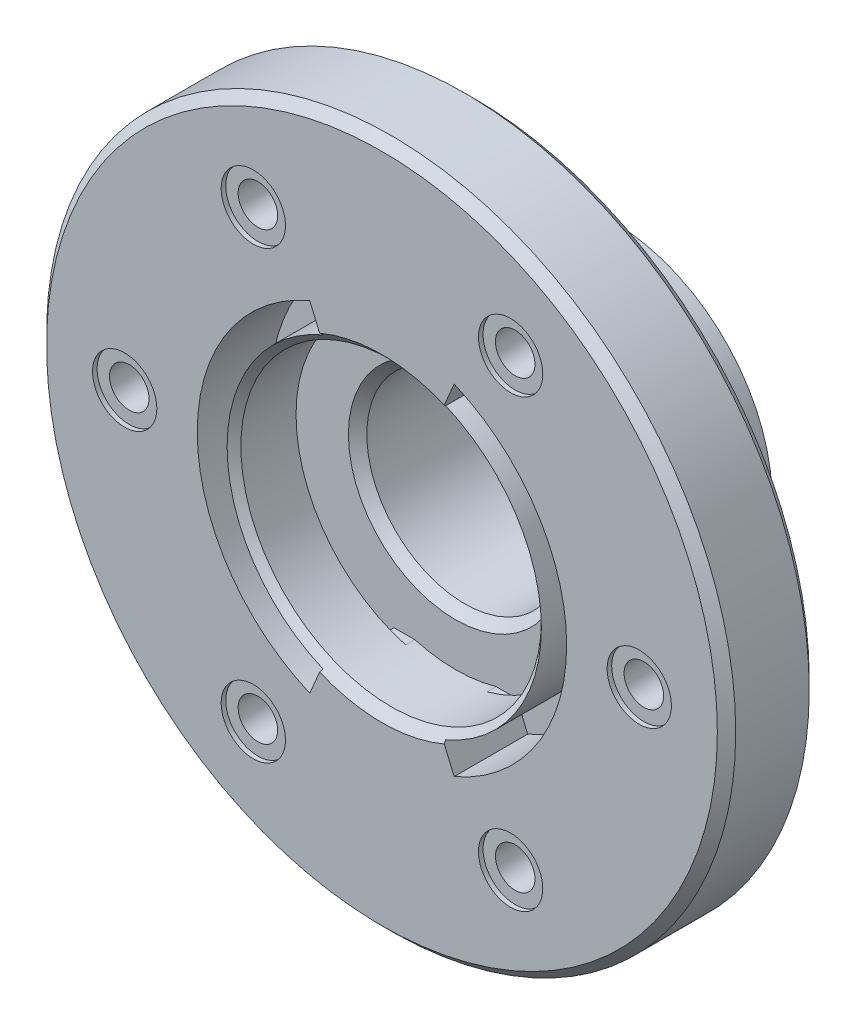
from build123d import *

# Parameters (mm, degrees)
SKETCH1_R                             = 37.5
BASE_PLATE_DEPTH                      = 5
SKETCH2_R                             = 6
PIN_DEPTH                             = 30
SKETCH11_R                            = 4
SCREWINSERTS_DEPTH                    = 5
INSERTSCIRPATTERN3_COUNT              = 6
SKETCH10_R                            = 2.15
SCREW_HOLES_DEPTH                     = 35
SCREWHOLEPATTERN1_OUTLINE_R           = 2.15
SCREWHOLEPATTERN1_DEPTH               = 5
SKETCH9_R                             = 3.5
PINHOLES_DEPTH                        = 0.5
PINHOLECIRPATTERN2_COUNT              = 6
SKETCH3_R                             = 17.45
OUTPUT_SHAFT_DEPTH                    = 15
SKETCH5_R                             = 16.35
BEARINGHOLE_DEPTH                     = 8
SKETCH6_R                             = 10.65
INPUTSHAFT_HOLE_DEPTH                 = 66.24185773
COMPLIANCE_CUT_DEPTH                  = 8
CHAMFER_2_SIZE                        = 1
WALL_COMPLIANCE_CIT_REACH             = 65.541
SKETCH13_W                            = 1
SKETCH13_H                            = 31.47761194
WALL_COMPLIANCE_CIT_DIRECTION_2_REACH = 65.541


# Read off the part's stored shape, not the designer's step: ScrewHolePattern1
with BuildPart() as part:
    # Sketch1 → Base Plate (new, symmetric)
    with BuildSketch(Plane.XY):
        Circle(SKETCH1_R)
    extrude(amount=BASE_PLATE_DEPTH, both=True)

    # Sketch11 → ScrewInserts (cut)
    with BuildSketch(Plane(origin=(0, 0, -5), x_dir=(-1, 0, 0), z_dir=(0, 0, -1))):
        with Locations((28, 0)):
            Circle(SKETCH11_R)
    screwinserts = extrude(amount=-SCREWINSERTS_DEPTH, mode=Mode.SUBTRACT)

    # InsertsCirPattern3: ScrewInserts ×6 about axis
    insertscirpattern3_axis = Axis((0, 0, 0), (0, 0, 1))
    for i in range(1, INSERTSCIRPATTERN3_COUNT):
        add(screwinserts.rotate(insertscirpattern3_axis, i * 360 / INSERTSCIRPATTERN3_COUNT), mode=Mode.SUBTRACT)


with BuildPart() as body_2:
    # Sketch2 → Pin (new body)
    with BuildSketch(Plane.XY.offset(5)):
        with Locations((-28, 0)):
            Circle(SKETCH2_R)
    extrude(amount=PIN_DEPTH)


with BuildPart() as screw_holes_tool:
    # Sketch10 → Screw Holes (new body)
    with BuildSketch(Plane.XY.offset(35)):
        with Locations((-28, 0)):
            Circle(SKETCH10_R)
    extrude(amount=-SCREW_HOLES_DEPTH)


with BuildPart() as part_1:
    add(part.part)

    # Screw Holes: cut by screw_holes_tool
    add(screw_holes_tool.part, mode=Mode.SUBTRACT)

    # ScrewHolePattern1 outline → ScrewHolePattern1 (cut)
    with BuildSketch(Plane.XY):
        with Locations((-14, 24.248711306)):
            Circle(SCREWHOLEPATTERN1_OUTLINE_R)
        with Locations((14, 24.248711306)):
            Circle(SCREWHOLEPATTERN1_OUTLINE_R)
        with Locations((28, 0)):
            Circle(SCREWHOLEPATTERN1_OUTLINE_R)
        with Locations((14, -24.248711306)):
            Circle(SCREWHOLEPATTERN1_OUTLINE_R)
        with Locations((-14, -24.248711306)):
            Circle(SCREWHOLEPATTERN1_OUTLINE_R)
    extrude(amount=SCREWHOLEPATTERN1_DEPTH, mode=Mode.SUBTRACT)

    # Sketch9 → PinHoles (cut)
    with BuildSketch(Plane.XY.offset(5)):
        with Locations((-28, 0)):
            Circle(SKETCH9_R)
    pinholes = extrude(amount=-PINHOLES_DEPTH, mode=Mode.SUBTRACT)

    # PinHoleCirPattern2: PinHoles ×6 about axis
    pinholecirpattern2_axis = Axis((0, 0, 0), (0, 0, 1))
    for i in range(1, PINHOLECIRPATTERN2_COUNT):
        add(pinholes.rotate(pinholecirpattern2_axis, i * 360 / PINHOLECIRPATTERN2_COUNT), mode=Mode.SUBTRACT)

    # Sketch3 → Output Shaft (add)
    with BuildSketch(Plane(origin=(0, 0, -5), x_dir=(-1, 0, 0), z_dir=(0, 0, -1))):
        Circle(SKETCH3_R)
    extrude(amount=OUTPUT_SHAFT_DEPTH)

    # Sketch5 → BearingHole (cut)
    with BuildSketch(Plane.XY.offset(5)):
        Circle(SKETCH5_R)
    extrude(amount=-BEARINGHOLE_DEPTH, mode=Mode.SUBTRACT)

    # Sketch6 → InputShaft Hole (cut, through all)
    with BuildSketch(Plane.XY.offset(-3)):
        Circle(SKETCH6_R)
    extrude(amount=-INPUTSHAFT_HOLE_DEPTH, mode=Mode.SUBTRACT)

    # Sketch12 → Compliance Cut (cut)
    with BuildSketch(Plane.XY.offset(5)):
        with BuildLine():
            Line((-7.858753082, 18.5), (-6.685804861, 15.73880597))
            ThreePointArc((-6.685804861, 15.73880597), (-17.1, 0), (-6.685804861, -15.73880597))
            Line((-6.685804861, -15.73880597), (-7.858753082, -18.5))
            ThreePointArc((-7.858753082, -18.5), (-20.1, 0), (-7.858753082, 18.5))
        make_face()
    compliance_cut = extrude(amount=-COMPLIANCE_CUT_DEPTH, mode=Mode.SUBTRACT)

    # Mirror1: Compliance Cut across plane
    add(compliance_cut.mirror(Plane(origin=(0, 0, 0), x_dir=(0, 0, 1), z_dir=(1, 0, 0))), mode=Mode.SUBTRACT)

    # Chamfer 2
    # the kernel refuses this chamfer: 1 mm, written as the material it takes off along each edge
    with BuildSketch(Plane(origin=(0, 0, 5), x_dir=(1, 0, 0), z_dir=(0, -1, 0))) as chamfer_2_piece_1:
        Polygon((37.5, -CHAMFER_2_SIZE), (37.5 - CHAMFER_2_SIZE, 0), (37.5, 0), align=None)
    revolve(axis=Axis((0, 0, 5), (0, 0, 1)), mode=Mode.SUBTRACT)
    with BuildSketch(Plane(origin=(0, 0, -5), x_dir=(1, 0, 0), z_dir=(0, -1, 0))) as chamfer_2_piece_2:
        Polygon((37.5, CHAMFER_2_SIZE), (37.5 - CHAMFER_2_SIZE, 0), (37.5, 0), align=None)
    revolve(axis=Axis((0, 0, -5), (0, 0, 1)), mode=Mode.SUBTRACT)
    with BuildSketch(Plane(origin=(0, 0, -20), x_dir=(1, 0, 0), z_dir=(0, -1, 0))) as chamfer_2_piece_3:
        Polygon((10.65 + CHAMFER_2_SIZE, 0), (10.65, CHAMFER_2_SIZE), (10.65, 0), align=None)
    revolve(axis=Axis((0, 0, -20), (0, 0, 1)), mode=Mode.SUBTRACT)
    with BuildSketch(Plane(origin=(0, 0, -3), x_dir=(1, 0, 0), z_dir=(0, -1, 0))) as chamfer_2_piece_4:
        Polygon((10.65 + CHAMFER_2_SIZE, 0), (10.65, -CHAMFER_2_SIZE), (10.65, 0), align=None)
    revolve(axis=Axis((0, 0, -3), (0, 0, 1)), mode=Mode.SUBTRACT)
    with BuildSketch(Plane(origin=(0, 0, 5), x_dir=(1, 0, 0), z_dir=(0, -1, 0))) as chamfer_2_piece_5:
        Polygon((16.35 + CHAMFER_2_SIZE, 0), (16.35, -CHAMFER_2_SIZE), (16.35, 0), align=None)
    revolve(axis=Axis((0, 0, 5), (0, 0, 1)), mode=Mode.SUBTRACT)

    # Sketch13 → Wall Compliance Cit (cut, up to next)
    with BuildSketch(Plane(origin=(0, 0, 0), x_dir=(0, 0, -1), z_dir=(1, 0, 0)), mode=Mode.PRIVATE) as wall_compliance_cit_sk1:
        with Locations((2.5, 0)):
            Rectangle(SKETCH13_W, SKETCH13_H)
    wall_compliance_cit_tool1 = extrude(wall_compliance_cit_sk1.sketch, amount=-WALL_COMPLIANCE_CIT_REACH, mode=Mode.PRIVATE) & part_1.part
    add(wall_compliance_cit_tool1.solids().sort_by_distance((0, 0, -2.5))[0], mode=Mode.SUBTRACT)

    # Sketch13 → Wall Compliance Cit direction 2 (cut, up to next)
    with BuildSketch(Plane(origin=(0, 0, 0), x_dir=(0, 0, -1), z_dir=(1, 0, 0)), mode=Mode.PRIVATE) as wall_compliance_cit_direction_2_sk1:
        with Locations((2.5, 0)):
            Rectangle(SKETCH13_W, SKETCH13_H)
    wall_compliance_cit_direction_2_tool1 = extrude(wall_compliance_cit_direction_2_sk1.sketch, amount=WALL_COMPLIANCE_CIT_DIRECTION_2_REACH, mode=Mode.PRIVATE) & part_1.part
    add(wall_compliance_cit_direction_2_tool1.solids().sort_by_distance((0, 0, -2.5))[0], mode=Mode.SUBTRACT)


with BuildPart() as body_2_1:
    add(body_2.part)

    # Screw Holes: cut by screw_holes_tool
    add(screw_holes_tool.part, mode=Mode.SUBTRACT)


solid = part_1.part
